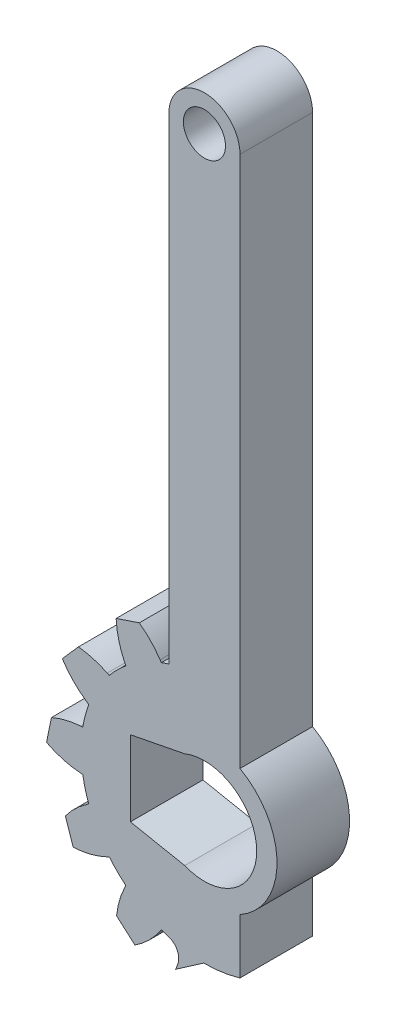
from build123d import *

# Parameters (mm, degrees)
SKETCH1_R           = 1.45
BOSS_EXTRUDE1_DEPTH = 5
CUT_EXTRUDE2_DEPTH  = 46.350212776
SKETCH5_W           = 3.6
SKETCH5_H           = 5
FILLET1_R           = 1


with BuildPart() as part:
    # Sketch1 → Boss-Extrude1 (new body)
    with BuildSketch(Plane.XY.offset(1.9)):
        with BuildLine():
            Line((2.45, -8.139256723), (2.45, -4.358612164))
            ThreePointArc((2.45, -4.358612164), (5, 0), (2.45, 4.358612164))
            Line((2.45, 4.358612164), (2.45, 41))
            ThreePointArc((2.45, 41), (0, 43.45), (-2.45, 41))
            Line((-2.45, 41), (-2.45, 8.139256723))
            ThreePointArc((-2.45, 8.139256723), (-2.710254715, 8.056334116), (-2.967710696, 7.965092167))
            Line((-2.967710696, 7.965092167), (-3.054167872, 8.093270203))
            ThreePointArc((-3.054167872, 8.093270203), (-4.342095244, 9.472160372), (-5.994566265, 10.382893341))
            ThreePointArc((-5.994566265, 10.382893341), (-6.032083889, 8.496444973), (-5.481893659, 6.691622066))
            Line((-5.481893659, 6.691622066), (-5.414116812, 6.552658937))
            ThreePointArc((-5.414116812, 6.552658937), (-6.01040764, 6.01040764), (-6.552658937, 5.414116812))
            Line((-6.552658937, 5.414116812), (-6.691622066, 5.481893659))
            ThreePointArc((-6.691622066, 5.481893659), (-8.496444973, 6.032083889), (-10.382893341, 5.994566265))
            ThreePointArc((-10.382893341, 5.994566265), (-9.472160372, 4.342095244), (-8.093270203, 3.054167872))
            Line((-8.093270203, 3.054167872), (-7.965092167, 2.967710696))
            ThreePointArc((-7.965092167, 2.967710696), (-8.210369523, 2.199961883), (-8.381827508, 1.41243323))
            Line((-8.381827508, 1.41243323), (-8.536061531, 1.401648136))
            ThreePointArc((-8.536061531, 1.401648136), (-10.374179133, 0.975715399), (-11.989132531, 0))
            ThreePointArc((-11.989132531, 0), (-10.374179133, -0.975715399), (-8.536061531, -1.401648136))
            Line((-8.536061531, -1.401648136), (-8.381827508, -1.41243323))
            ThreePointArc((-8.381827508, -1.41243323), (-8.210369523, -2.199961883), (-7.965092167, -2.967710696))
            Line((-7.965092167, -2.967710696), (-8.093270203, -3.054167872))
            ThreePointArc((-8.093270203, -3.054167872), (-9.472160372, -4.342095244), (-10.382893341, -5.994566265))
            ThreePointArc((-10.382893341, -5.994566265), (-8.496444973, -6.032083889), (-6.691622066, -5.481893659))
            Line((-6.691622066, -5.481893659), (-6.552658937, -5.414116812))
            ThreePointArc((-6.552658937, -5.414116812), (-6.01040764, -6.01040764), (-5.414116812, -6.552658937))
            Line((-5.414116812, -6.552658937), (-5.481893659, -6.691622066))
            ThreePointArc((-5.481893659, -6.691622066), (-6.032083889, -8.496444973), (-5.994566265, -10.382893341))
            ThreePointArc((-5.994566265, -10.382893341), (-4.342095244, -9.472160372), (-3.054167872, -8.093270203))
            Line((-3.054167872, -8.093270203), (-2.967710696, -7.965092167))
            ThreePointArc((-2.967710696, -7.965092167), (-2.212026244, -8.207127384), (-1.437064557, -8.377639611))
            Line((-1.437064557, -8.377639611), (-1.984198903, -9.839001099))
            Line((-1.984198903, -9.839001099), (-0.052960828, -8.499835007))
            ThreePointArc((-0.052960828, -8.499835007), (1.212003867, -8.413147249), (2.45, -8.139256723))
        make_face()
        with Locations((0, 41)):
            Circle(SKETCH1_R, mode=Mode.SUBTRACT)
    extrude(amount=-BOSS_EXTRUDE1_DEPTH)

    # Sketch4 → Cut-Extrude2 (cut, through all)
    with BuildSketch(Plane.XY.offset(1.9)):
        with BuildLine():
            Line((-5.102940329, -2.6), (-1.358771093, -3.333727811))
            ThreePointArc((-1.358771093, -3.333727811), (-3.6, 0), (-1.358771093, 3.333727811))
            Line((-1.358771093, 3.333727811), (-5.102940329, 2.6))
            Line((-5.102940329, 2.6), (-5.102940329, -2.6))
        make_face()
    extrude(amount=-CUT_EXTRUDE2_DEPTH, mode=Mode.SUBTRACT)

    # Sketch5 → Cut-Revolve1 (revolve, cut)
    with BuildSketch(Plane(origin=(0, 0, 0), x_dir=(1, 0, 0), z_dir=(0, 1, 0))):
        with Locations((1.8, 0.6)):
            Rectangle(SKETCH5_W, SKETCH5_H)
    revolve(axis=Axis((0, 0, -3.1), (0, 0, 1)), mode=Mode.SUBTRACT)

    # Chamfer1
    # the kernel refuses this chamfer: 1.996823512, 1.412365401 mm, written as the material it takes off along each edge
    with BuildSketch(Plane(origin=(-5.994566265, -10.382893341, 6.307600342), x_dir=(0.8971018613244867, 0.44182377754953556, 0), z_dir=(0, 0, -1)), Plane(origin=(-10.382893341, -5.994566265, 6.307600342), x_dir=(0.9978248904640776, -0.06592031530834441, 0), z_dir=(0, 0, -1)), Plane(origin=(-11.989132531, 0, 6.307600342), x_dir=(0.8311815460161395, -0.5560011129145519, 0), z_dir=(0, 0, -1)), Plane(origin=(-10.382893341, 5.994566265, 6.307600342), x_dir=(0.4418237775496057, -0.8971018613244522, 0), z_dir=(0, 0, -1)), Plane(origin=(-5.994566265, 10.382893341, 6.307600342), x_dir=(-0.06592031530837167, -0.9978248904640757, 0), z_dir=(0, 0, -1))) as chamfer1_piece_1:
        with BuildLine():
            Line((1.33889649, 0), (0.700148491, -1.556942978))
            ThreePointArc((0.700148491, -1.556942978), (0.305807457, -0.828670891), (0, 0))
            ThreePointArc((0, 0), (0.684607685, 0.037444556), (1.33889649, 0))
        make_face()
    extrude(amount=13.815200684, mode=Mode.SUBTRACT)

    # Fillet1
    fillet1_edges = [part.edges().sort_by_distance(p)[0] for p in [
        (-1.437064557, -8.377639611, -0.6),
    ]]
    fillet(fillet1_edges, radius=FILLET1_R)


solid = part.part
